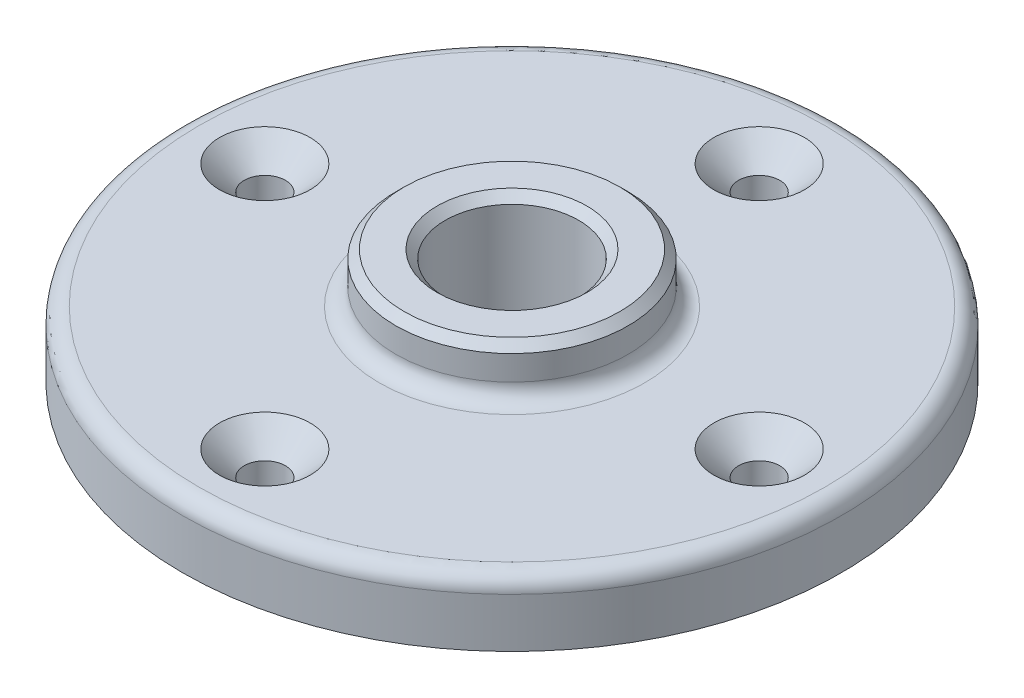
from build123d import *

# Parameters (mm, degrees)
SKETCH1_R                    = 20
BOSS_EXTRUDE1_DEPTH          = 4
SKETCH2_R                    = 4.05
CUT_EXTRUDE1_DEPTH           = 29.565713714
SKETCH3_R                    = 1.25
CUT_EXTRUDE2_DEPTH           = 29.565713714
CHAMFER1_SIZE                = 1.5
CIRPATTERN1_COUNT            = 4
CHAMFER1_OF_CIRPATTERN1_SIZE = 1.5
FILLET1_R                    = 1
BOSS_EXTRUDE2_START          = 3
SKETCH4_R                    = 7.05
SKETCH4_R_2                  = 4.05
BOSS_EXTRUDE2_DEPTH          = 3
CHAMFER2_SIZE                = 0.5
FILLET2_R                    = 1
CHAMFER3_SIZE                = 0.5


with BuildPart() as part:
    # Sketch1 → Boss-Extrude1 (new body)
    with BuildSketch(Plane(origin=(0, 0, 0), x_dir=(1, 0, 0), z_dir=(0, 1, 0))):
        Circle(SKETCH1_R)
    extrude(amount=BOSS_EXTRUDE1_DEPTH)

    # Sketch2 → Cut-Extrude1 (cut, through all)
    with BuildSketch(Plane(origin=(0, 4, 0), x_dir=(1, 0, 0), z_dir=(0, 1, 0))):
        Circle(SKETCH2_R)
    extrude(amount=-CUT_EXTRUDE1_DEPTH, mode=Mode.SUBTRACT)

    # Sketch3 → Cut-Extrude2 (cut, through all)
    with BuildSketch(Plane(origin=(0, 4, 0), x_dir=(1, 0, 0), z_dir=(0, 1, 0))):
        with Locations((0, 15)):
            Circle(SKETCH3_R)
    cut_extrude2 = extrude(amount=-CUT_EXTRUDE2_DEPTH, mode=Mode.SUBTRACT)

    # Chamfer1
    chamfer1_edges = [part.edges().sort_by_distance(p)[0] for p in [
        (-1.25, 4, -15),
    ]]
    chamfer(chamfer1_edges, length=CHAMFER1_SIZE)

    # CirPattern1: Cut-Extrude2 ×4 about axis
    cirpattern1_axis = Axis((0, 0, 0), (0, 1, 0))
    for i in range(1, CIRPATTERN1_COUNT):
        add(cut_extrude2.rotate(cirpattern1_axis, i * 360 / CIRPATTERN1_COUNT), mode=Mode.SUBTRACT)

    # Chamfer1 of CirPattern1
    chamfer1_of_cirpattern1_edges = [part.edges().sort_by_distance(p)[0] for p in [
        (-15, 4, 1.25),
        (1.25, 4, 15),
        (15, 4, -1.25),
    ]]
    chamfer(chamfer1_of_cirpattern1_edges, length=CHAMFER1_OF_CIRPATTERN1_SIZE)

    # Fillet1
    fillet1_edges = [part.edges().sort_by_distance(p)[0] for p in [
        (-20, 4, 0),
    ]]
    fillet(fillet1_edges, radius=FILLET1_R)

    # Sketch4 → Boss-Extrude2 (add)
    with BuildSketch(Plane(origin=(0, 4, 0), x_dir=(1, 0, 0), z_dir=(0, 1, 0)).offset(BOSS_EXTRUDE2_START)):
        Circle(SKETCH4_R)
        Circle(SKETCH4_R_2, mode=Mode.SUBTRACT)
    extrude(amount=-BOSS_EXTRUDE2_DEPTH)

    # Chamfer2
    chamfer2_edges = [part.edges().sort_by_distance(p)[0] for p in [
        (-4.05, 7, 0),
    ]]
    chamfer(chamfer2_edges, length=CHAMFER2_SIZE)

    # Fillet2
    fillet2_edges = [part.edges().sort_by_distance(p)[0] for p in [
        (-7.05, 4, 0),
    ]]
    fillet(fillet2_edges, radius=FILLET2_R)

    # Chamfer3
    chamfer3_edges = [part.edges().sort_by_distance(p)[0] for p in [
        (-7.05, 7, 0),
    ]]
    chamfer(chamfer3_edges, length=CHAMFER3_SIZE)


solid = part.part
